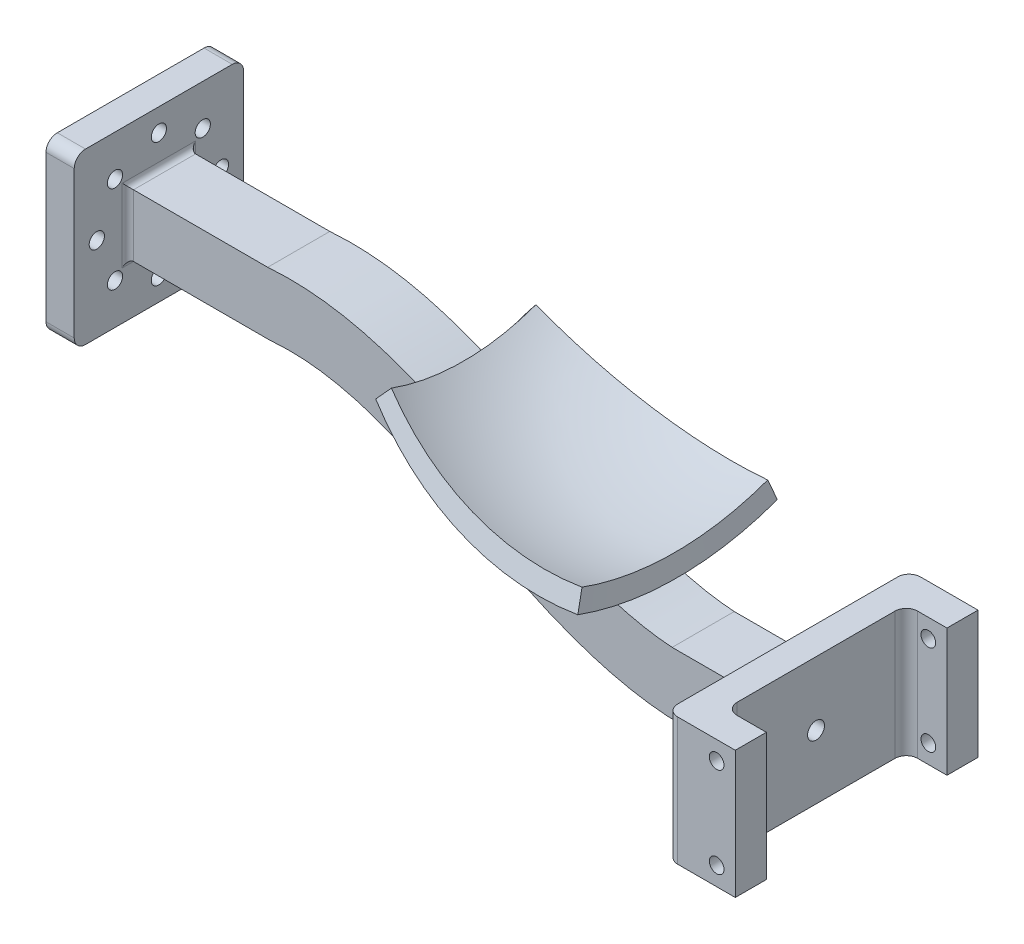
from build123d import *

# Parameters (mm, degrees)
BOSS_EXTRUDE1_DEPTH      = 45
SKETCH4_R                = 1.35
CUT_EXTRUDE3_DEPTH       = 25.4
SKETCH16_W               = 54.601375451
SKETCH16_H               = 80.563035577
CUT_EXTRUDE6_DEPTH       = 86.719849393
SKETCH17_W               = 45
SKETCH17_H               = 36.75
SKETCH17_W_2             = 30
SKETCH17_H_2             = 30
CUT_EXTRUDE7_DEPTH       = 74.310606081
SKETCH18_R               = 1.35
CUT_EXTRUDE8_DEPTH       = 64.93499752
FILLET1_R                = 2
SKETCH19_W               = 11
SKETCH19_H               = 11
BOSS_EXTRUDE2_DEPTH      = 25
SKETCH20_W               = 5
SKETCH20_H               = 5
CUT_EXTRUDE9_DEPTH       = 25
EXTRUDE_THIN2_START      = -11
EXTRUDE_THIN2_DEPTH      = 11
BOSS_EXTRUDE3_DEPTH      = 11
CUT_EXTRUDE_THIN1_START  = -7.5
CUT_EXTRUDE_THIN1_DEPTH  = 3.5
BOSS_EXTRUDE4_DEPTH      = 11
SKETCH25_R               = 1.5
CUT_EXTRUDE11_DEPTH      = 33
SKETCH26_W               = 11
SKETCH26_H               = 10.975223596
BOSS_EXTRUDE5_DEPTH      = 14.986
SKETCH27_W               = 43
SKETCH27_H               = 22.6
BOSS_EXTRUDE6_DEPTH      = 7
SKETCH28_W               = 5.5
SKETCH28_H               = 22.6
BOSS_EXTRUDE7_DEPTH      = 5.2
SKETCH29_R               = 1.3
CUT_EXTRUDE12_DEPTH      = 6
SKETCH31_W               = 2
SKETCH31_H               = 32
CUT_EXTRUDE13_DEPTH      = 176.973849112
SKETCH32_R               = 1.5
CUT_EXTRUDE14_DEPTH      = 20
FILLET2_R                = 3
FILLET3_R                = 1
FILLET4_R                = 2
REVOLVE5_ANGLE           = 20
REVOLVE5_OTHER_WAY_ANGLE = 20


# Read off the part's stored shape, not the designer's step: Extrude-Thin2, Cut-Extrude-Thin1
with BuildPart() as part:
    # Sketch1 → Boss-Extrude1 (new body)
    with BuildSketch(Plane.XY):
        Polygon((-3.796, -4.492), (-3.796, 57.658), (44.704, 57.658), (44.704, 20.908), (39.704, 20.908), (39.704, 52.658), (1.204, 52.658), (1.204, -4.492), align=None)
    extrude(amount=BOSS_EXTRUDE1_DEPTH)

    # Sketch4 → Cut-Extrude3 (cut)
    with BuildSketch(Plane(origin=(44.704, 0, 0), x_dir=(0, 0, -1), z_dir=(1, 0, 0))):
        with Locations(Location((-22.6336, 47.4432, 0), (0, 0, 90))):
            Circle(SKETCH4_R)
        with Locations(Location((-22.6336, 25.448, 0), (0, 0, 90))):
            Circle(SKETCH4_R)
        with Locations(Location((-11.6341, 36.4435, 0), (0, 0, 90))):
            Circle(SKETCH4_R)
        with Locations(Location((-33.6321, 36.4435, 0), (0, 0, 90))):
            Circle(SKETCH4_R)
    extrude(amount=-CUT_EXTRUDE3_DEPTH, mode=Mode.SUBTRACT)

    # Sketch16 → Cut-Extrude6 (cut, through all)
    with BuildSketch(Plane.XY.offset(45)):
        with Locations((12.403312274, 23.911522997)):
            Rectangle(SKETCH16_W, SKETCH16_H)
    extrude(amount=-CUT_EXTRUDE6_DEPTH, mode=Mode.SUBTRACT)

    # Sketch17 → Cut-Extrude7 (cut, through all)
    with BuildSketch(Plane(origin=(44.704, 0, 0), x_dir=(0, 0, -1), z_dir=(1, 0, 0))):
        with Locations((-22.5, 39.283)):
            Rectangle(SKETCH17_W, SKETCH17_H)
        with Locations((-22.6331, 36.4435)):
            Rectangle(SKETCH17_W_2, SKETCH17_H_2, mode=Mode.SUBTRACT)
    extrude(amount=-CUT_EXTRUDE7_DEPTH, mode=Mode.SUBTRACT)

    # Sketch18 → Cut-Extrude8 (cut, through all)
    with BuildSketch(Plane(origin=(44.704, 0, 0), x_dir=(0, 0, -1), z_dir=(1, 0, 0))):
        with Locations(Location((-14.857193174, 44.222006826, 0), (0, 0, 90))):
            Circle(SKETCH18_R)
        with Locations(Location((-30.410360379, 28.668839621, 0), (0, 0, 90))):
            Circle(SKETCH18_R)
        with Locations(Location((-14.856839621, 28.668839621, 0), (0, 0, 90))):
            Circle(SKETCH18_R)
        with Locations(Location((-30.410360379, 44.222006826, 0), (0, 0, 90))):
            Circle(SKETCH18_R)
    extrude(amount=-CUT_EXTRUDE8_DEPTH, mode=Mode.SUBTRACT)

    # Fillet1
    fillet1_edges = [part.edges().sort_by_distance(p)[0] for p in [
        (42.204, 51.4435, 7.6331),
        (42.204, 51.4435, 37.6331),
        (42.204, 21.4435, 37.6331),
        (42.204, 21.4435, 7.6331),
    ]]
    fillet(fillet1_edges, radius=FILLET1_R)

    # Sketch19 → Boss-Extrude2 (add)
    with BuildSketch(Plane(origin=(44.704, 0, 0), x_dir=(0, 0, -1), z_dir=(1, 0, 0))):
        with Locations((-22.6336, 36.4435)):
            Rectangle(SKETCH19_W, SKETCH19_H)
    extrude(amount=BOSS_EXTRUDE2_DEPTH)

    # Sketch20 → Cut-Extrude9 (cut)
    with BuildSketch(Plane(origin=(69.704, 0, 0), x_dir=(0, 0, -1), z_dir=(1, 0, 0))):
        with Locations((-22.6336, 36.4435)):
            Rectangle(SKETCH20_W, SKETCH20_H)
    extrude(amount=-CUT_EXTRUDE9_DEPTH, mode=Mode.SUBTRACT)

    # Extrude-Thin2 outline → Extrude-Thin2 (add)
    with BuildSketch(Plane.XY.offset(28.1336).offset(EXTRUDE_THIN2_START)):
        with BuildLine():
            add(Edge.make_bspline(
                [(69.485571332, 41.9435), (73.189889254, 42.229894097), (76.756573299, 42.093995367), (83.667623565, 41.168765869), (87.005163379, 40.368071931), (93.409336444, 38.34036703), (96.477342813, 37.114131259), (102.419444891, 34.457024987), (105.294405453, 33.025886698), (110.928837304, 30.153805586), (113.688467859, 28.712725451), (119.157005774, 25.998388612), (121.865540987, 24.725350349), (127.286389024, 22.506520049), (129.997607826, 21.560779698), (135.489440145, 20.130750965), (138.26910364, 19.645134005), (141.140114675, 19.452111798)],
                knots=[0.002539936, 0.002539936, 0.002539936, 0.002539936, 0.125, 0.125, 0.25, 0.25, 0.375, 0.375, 0.5, 0.5, 0.625, 0.625, 0.75, 0.75, 0.875, 0.875, 1, 1, 1, 1], degree=3))
            Line((69.485571332, 41.9435), (69.704, 41.9435))
            Line((69.704, 41.9435), (69.704, 38.9435))
            Line((69.704, 38.9435), (69.49918003, 38.9435))
            Line((69.49918003, 38.9435), (70.153099234, 30.961866131))
            add(Edge.make_bspline(
                [(70.153099234, 30.961866131), (73.119648486, 31.204909542), (75.949039399, 31.103966697), (81.484976681, 30.362832966), (84.192204039, 29.720510923), (89.581521353, 28.014132126), (92.262238192, 26.949300184), (97.653882984, 24.538339718), (100.363946084, 23.192478985), (105.868206432, 20.386751167), (108.662244415, 18.927021395), (114.402032868, 16.078047961), (117.348155486, 14.688585856), (123.469956826, 12.182845388), (126.64672957, 11.066515337), (133.296558477, 9.334953655), (136.770564663, 8.721050602), (140.402234585, 8.476888202)],
                knots=[0, 0, 0, 0, 0.125, 0.125, 0.25, 0.25, 0.375, 0.375, 0.5, 0.5, 0.625, 0.625, 0.75, 0.75, 0.875, 0.875, 1, 1, 1, 1], degree=3))
            Line((140.402234585, 8.476888202), (141.140114675, 19.452111798))
        make_face()
    extrude(amount=EXTRUDE_THIN2_DEPTH)

    # Sketch22 → Boss-Extrude3 (add)
    with BuildSketch(Plane.XY.offset(28.1336)):
        Polygon((69.704, 36.4435), (69.704, 30.9435), (70.153099234, 30.961866131), align=None)
    extrude(amount=-BOSS_EXTRUDE3_DEPTH)

    # Cut-Extrude-Thin1 outline → Cut-Extrude-Thin1 (cut)
    with BuildSketch(Plane.XY.offset(28.1336).offset(CUT_EXTRUDE_THIN1_START)):
        with BuildLine():
            Line((69.704, 36.4435), (69.928549617, 33.702683065))
            add(Edge.make_bspline(
                [(69.928549617, 33.702683065), (73.100204733, 33.962530388), (76.133189079, 33.853848009), (82.030638402, 33.064316192), (84.895443874, 32.382401175), (90.538475126, 30.595690852), (93.316014347, 29.490507952), (98.84527346, 27.018011036), (101.596560926, 25.650830913), (107.13336415, 22.828514772), (109.918800276, 21.373447409), (115.590776094, 18.558133123), (118.477501861, 17.19777698), (124.424064876, 14.763764053), (127.484449134, 13.690081427), (133.844778894, 12.033902983), (137.145199407, 11.452071453), (140.586704607, 11.220694101)],
                knots=[0, 0, 0, 0, 0.125, 0.125, 0.25, 0.25, 0.375, 0.375, 0.5, 0.5, 0.625, 0.625, 0.75, 0.75, 0.875, 0.875, 1, 1, 1, 1], degree=3))
            Line((140.586704607, 11.220694101), (140.955644652, 16.708305899))
            add(Edge.make_bspline(
                [(69.479450383, 39.184316935), (73.061317226, 39.477772078), (76.501488438, 39.353610632), (83.121961844, 38.467282643), (86.301923544, 37.706181679), (92.452382672, 35.758808304), (95.423566658, 34.57292349), (101.228054414, 31.97735367), (104.061790611, 30.56753477), (109.663679586, 27.712041981), (112.431911998, 26.266299437), (117.968262547, 23.518303449), (120.736194612, 22.216159226), (126.332280975, 19.925601384), (129.159888262, 18.937213608), (134.941219728, 17.431801637), (137.894468895, 16.914113154), (140.955644652, 16.708305899)],
                knots=[0, 0, 0, 0, 0.125, 0.125, 0.25, 0.25, 0.375, 0.375, 0.5, 0.5, 0.625, 0.625, 0.75, 0.75, 0.875, 0.875, 1, 1, 1, 1], degree=3))
            Line((69.479450383, 39.184316935), (69.49918003, 38.9435))
            Line((69.49918003, 38.9435), (69.704, 36.4435))
        make_face()
    extrude(amount=CUT_EXTRUDE_THIN1_DEPTH, mode=Mode.SUBTRACT)

    # Sketch23 → Boss-Extrude4 (add)
    with BuildSketch(Plane(origin=(0, 0, 17.1336), x_dir=(-1, 0, 0), z_dir=(0, 0, -1))):
        Polygon((-141.140114675, 19.452111798), (-140.402234585, 8.476888202), (-141.140114675, 8.476888202), align=None)
    extrude(amount=-BOSS_EXTRUDE4_DEPTH)

    # Sketch25 → Cut-Extrude11 (cut)
    with BuildSketch(Plane.ZY.offset(-39.704)):
        with Locations(Location((22.6331, 36.4435, 0), (0, 0, 270))):
            Circle(SKETCH25_R)
    extrude(amount=-CUT_EXTRUDE11_DEPTH, mode=Mode.SUBTRACT)

    # Sketch26 → Boss-Extrude5 (add)
    with BuildSketch(Plane(origin=(141.140114675, 0, 0), x_dir=(0, 0, -1), z_dir=(1, 0, 0))):
        with Locations((-22.6336, 13.9645)):
            Rectangle(SKETCH26_W, SKETCH26_H)
    extrude(amount=BOSS_EXTRUDE5_DEPTH)

    # Sketch27 → Boss-Extrude6 (add)
    with BuildSketch(Plane(origin=(156.126114675, 0, 0), x_dir=(0, 0, -1), z_dir=(1, 0, 0))):
        with Locations((-22.6336, 13.9645)):
            Rectangle(SKETCH27_W, SKETCH27_H)
    extrude(amount=BOSS_EXTRUDE6_DEPTH)

    # Sketch28 → Boss-Extrude7 (add)
    with BuildSketch(Plane(origin=(163.126114675, 0, 0), x_dir=(0, 0, -1), z_dir=(1, 0, 0))):
        with Locations((-3.8836, 13.9645)):
            Rectangle(SKETCH28_W, SKETCH28_H)
    boss_extrude7 = extrude(amount=BOSS_EXTRUDE7_DEPTH)

    # Sketch29 → Cut-Extrude12 (cut)
    with BuildSketch(Plane(origin=(0, 0, 1.1336), x_dir=(-1, 0, 0), z_dir=(0, 0, -1))):
        with Locations((-165.026114675, 21.9645)):
            Circle(SKETCH29_R)
        with Locations((-165.026114675, 5.9645)):
            Circle(SKETCH29_R)
    cut_extrude12 = extrude(amount=-CUT_EXTRUDE12_DEPTH, mode=Mode.SUBTRACT)

    # Mirror1: Boss-Extrude7, Cut-Extrude12 across plane
    add(boss_extrude7.mirror(Plane(origin=(0, 0, 22.6336), x_dir=(1, 0, 0), z_dir=(0, 0, -1))))
    add(cut_extrude12.mirror(Plane(origin=(0, 0, 22.6336), x_dir=(1, 0, 0), z_dir=(0, 0, -1))), mode=Mode.SUBTRACT)

    # Sketch31 → Cut-Extrude13 (cut, through all)
    with BuildSketch(Plane(origin=(0, 25.2645, 0), x_dir=(1, 0, 0), z_dir=(0, 1, 0))):
        with Locations((162.126114675, -22.6336)):
            Rectangle(SKETCH31_W, SKETCH31_H)
    extrude(amount=-CUT_EXTRUDE13_DEPTH, mode=Mode.SUBTRACT)

    # Sketch32 → Cut-Extrude14 (cut)
    with BuildSketch(Plane(origin=(161.126114675, 0, 0), x_dir=(0, 0, -1), z_dir=(1, 0, 0))):
        with Locations((-22.6336, 13.9645)):
            Circle(SKETCH32_R)
    extrude(amount=-CUT_EXTRUDE14_DEPTH, mode=Mode.SUBTRACT)

    # Fillet2
    fillet2_edges = [part.edges().sort_by_distance(p)[0] for p in [
        (156.126114675, 13.9645, 17.1336),
        (156.126114675, 19.452111798, 22.6336),
        (156.126114675, 13.9645, 28.1336),
        (156.126114675, 8.476888202, 22.6336),
    ]]
    fillet(fillet2_edges, radius=FILLET2_R)

    # Fillet3
    fillet3_edges = [part.edges().sort_by_distance(p)[0] for p in [
        (44.704, 36.4435, 17.1336),
        (44.704, 41.9435, 22.6336),
        (44.704, 36.4435, 28.1336),
        (44.704, 30.9435, 22.6336),
    ]]
    fillet(fillet3_edges, radius=FILLET3_R)

    # Fillet4
    fillet4_edges = [part.edges().sort_by_distance(p)[0] for p in [
        (156.126114675, 13.9645, 1.1336),
        (156.126114675, 13.9645, 44.1336),
        (161.126114675, 13.9645, 38.6336),
        (161.126114675, 13.9645, 6.6336),
    ]]
    fillet(fillet4_edges, radius=FILLET4_R)

    # Sketch34 → Revolve5 (revolve)
    with BuildSketch(Plane(origin=(0, 0, 22.6336), x_dir=(-1, 0, 0), z_dir=(0, 0, -1))):
        with BuildLine():
            Line((-136.11675419, 28.748502089), (-136.605032276, 25.155034121))
            ThreePointArc((-136.605032276, 25.155034121), (-115.392998497, 26.792821567), (-96.735320654, 37.016508882))
            Line((-96.735320654, 37.016508882), (-98.700561651, 39.399154818))
            ThreePointArc((-98.700561651, 39.399154818), (-116.294824102, 30.160883243), (-136.11675419, 28.748502089))
        make_face()
    revolve(axis=Axis((161.922701843, 76.839789614, 22.6336), (-1, 0, 0)), revolution_arc=REVOLVE5_ANGLE)

    # Sketch34 → Revolve5 other way (revolve)
    with BuildSketch(Plane(origin=(0, 0, 22.6336), x_dir=(-1, 0, 0), z_dir=(0, 0, -1))):
        with BuildLine():
            Line((-136.11675419, 28.748502089), (-136.605032276, 25.155034121))
            ThreePointArc((-136.605032276, 25.155034121), (-115.392998497, 26.792821567), (-96.735320654, 37.016508882))
            Line((-96.735320654, 37.016508882), (-98.700561651, 39.399154818))
            ThreePointArc((-98.700561651, 39.399154818), (-116.294824102, 30.160883243), (-136.11675419, 28.748502089))
        make_face()
    revolve(axis=Axis((161.922701843, 76.839789614, 22.6336), (1, 0, 0)), revolution_arc=REVOLVE5_OTHER_WAY_ANGLE)


solid = part.part
